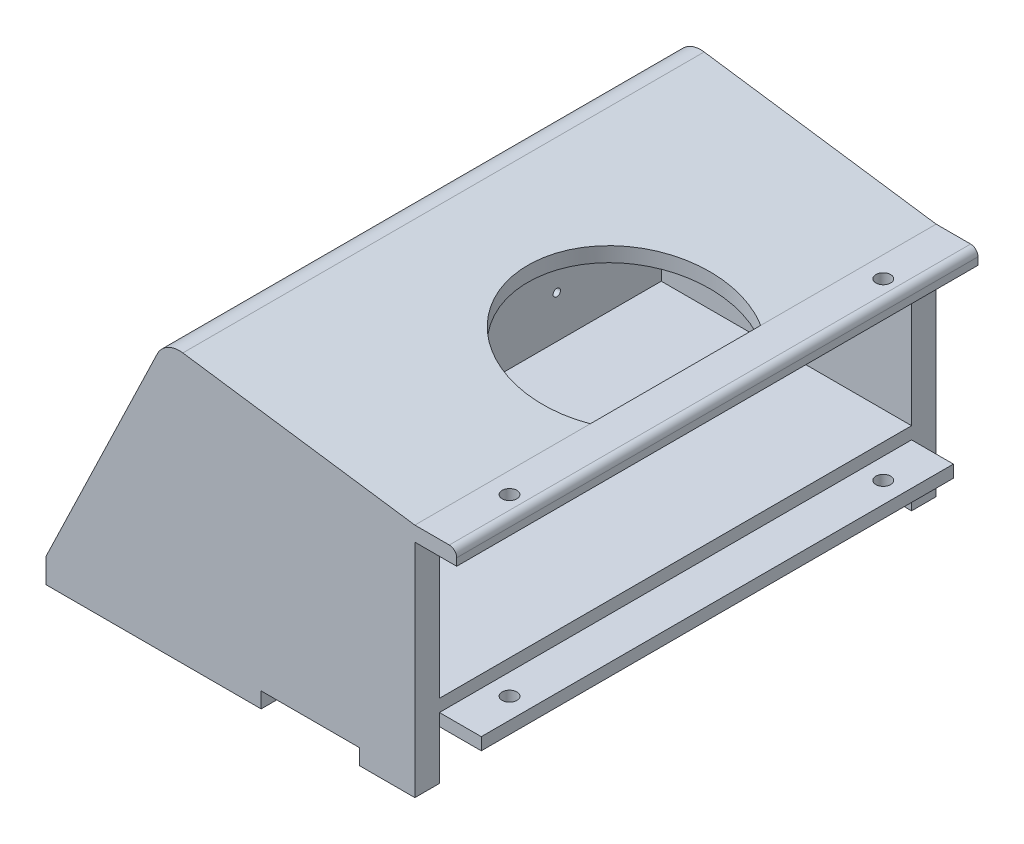
from build123d import *

# Parameters (mm, degrees)
BOSS_EXTRUDE1_DEPTH     = 212
CUT_EXTRUDE1_REACH      = 286.655
SKETCH2_W               = 17.02
SKETCH2_H               = 10
SKETCH3_R               = 1.5
CUT_EXTRUDE2_DEPTH      = 15
CUT_EXTRUDE3_DEPTH      = 292.629987014
CUT_EXTRUDE3_DEPTH_BACK = 292.629987014
SKETCH4_R               = 3
SKETCH5_W               = 30
SKETCH5_H               = 15
CUT_EXTRUDE4_DEPTH      = 15
CUT_EXTRUDE5_DEPTH      = 287.453626963
CUT_EXTRUDE5_DEPTH_BACK = 287.453626963
SKETCH6_R               = 3
BOSS_EXTRUDE2_DEPTH     = 10
BOSS_EXTRUDE3_DEPTH     = 10
CUT_EXTRUDE6_DEPTH      = 287.453626963
CUT_EXTRUDE6_DEPTH_BACK = 287.453626963
SKETCH9_W               = 40
SKETCH9_H               = 6.35
CUT_EXTRUDE9_DEPTH      = 25
CUT_EXTRUDE9_DEPTH_BACK = 27
SKETCH11_R              = 7.5
CUT_EXTRUDE10_DEPTH     = 288.989964348
SKETCH12_R              = 4
CUT_EXTRUDE11_DEPTH     = 264.602807269
FILLET2_R               = 10
FILLET3_R               = 3


with BuildPart() as part:
    # Sketch1 → Boss-Extrude1 (new body)
    with BuildSketch(Plane.XY):
        Polygon((0, 0), (0, -6), (-17.02, -6), (-118.8, 8.518342212), (-118.8, -66), (-17.02, -66), (-17.02, -71), (0, -71), (0, -76), (-130.862615106, -76), (-147.02, -96), (-167.02, -96), (-167.02, -86), (-118.611740262, 14.491488024), (-17.02, 0), align=None)
    extrude(amount=BOSS_EXTRUDE1_DEPTH)

    # Sketch2 → Cut-Extrude1 (cut, up to next)
    with BuildSketch(Plane.XZ.offset(76), mode=Mode.PRIVATE) as cut_extrude1_sk1:
        with Locations((-8.51, 207)):
            Rectangle(SKETCH2_W, SKETCH2_H)
    cut_extrude1_tool1 = extrude(cut_extrude1_sk1.sketch, amount=-CUT_EXTRUDE1_REACH, mode=Mode.PRIVATE) & part.part
    # Sketch2 → Cut-Extrude1 (cut, up to next)
    with BuildSketch(Plane.XZ.offset(76), mode=Mode.PRIVATE) as cut_extrude1_sk2:
        with Locations((-8.51, 5)):
            Rectangle(SKETCH2_W, SKETCH2_H)
    cut_extrude1_tool2 = extrude(cut_extrude1_sk2.sketch, amount=-CUT_EXTRUDE1_REACH, mode=Mode.PRIVATE) & part.part
    add(cut_extrude1_tool1.solids().sort_by_distance((-8.51, -76, 207))[0], mode=Mode.SUBTRACT)
    add(cut_extrude1_tool2.solids().sort_by_distance((-8.51, -76, 5))[0], mode=Mode.SUBTRACT)

    # Sketch3 → Cut-Extrude2 (cut)
    with BuildSketch(Plane(origin=(-118.8, 0, 0), x_dir=(0, 0, -1), z_dir=(1, 0, 0))):
        with Locations((-159.5, -8.731657788)):
            Circle(SKETCH3_R)
        with Locations((-159.5, -48.731657788)):
            Circle(SKETCH3_R)
        with Locations((-52.5, -48.731657788)):
            Circle(SKETCH3_R)
        with Locations((-52.5, -8.731657788)):
            Circle(SKETCH3_R)
    extrude(amount=-CUT_EXTRUDE2_DEPTH, mode=Mode.SUBTRACT)

    # Sketch4 → Cut-Extrude3 (cut, two sides: drawn at the far end of the back side and taken through both)
    with BuildSketch(Plane(origin=(0, -96, 0), x_dir=(1, 0, 0), z_dir=(0, 1, 0)).offset(-CUT_EXTRUDE3_DEPTH_BACK)):
        with Locations((-157.02, -187)):
            Circle(SKETCH4_R)
        with Locations((-157.02, -25)):
            Circle(SKETCH4_R)
    extrude(amount=CUT_EXTRUDE3_DEPTH + CUT_EXTRUDE3_DEPTH_BACK, mode=Mode.SUBTRACT)

    # Sketch5 → Cut-Extrude4 (cut)
    with BuildSketch(Plane(origin=(0, -66, 0), x_dir=(1, 0, 0), z_dir=(0, 1, 0))):
        with Locations((-98.8, -184.31184426)):
            Rectangle(SKETCH5_W, SKETCH5_H)
    extrude(amount=-CUT_EXTRUDE4_DEPTH, mode=Mode.SUBTRACT)

    # Sketch6 → Cut-Extrude5 (cut, two sides: drawn at the far end of the back side and taken through both)
    with BuildSketch(Plane(origin=(0, 0, 0), x_dir=(1, 0, 0), z_dir=(0, 1, 0)).offset(-CUT_EXTRUDE5_DEPTH_BACK)):
        with Locations((-8.52, -30)):
            Circle(SKETCH6_R)
        with Locations((-8.52, -182)):
            Circle(SKETCH6_R)
    extrude(amount=CUT_EXTRUDE5_DEPTH + CUT_EXTRUDE5_DEPTH_BACK, mode=Mode.SUBTRACT)

    # Sketch7 → Boss-Extrude2 (add)
    with BuildSketch(Plane.XY.offset(212)):
        Polygon((-17.02, 0), (-118.611740262, 14.491488024), (-167.02, -86), (-167.02, -96), (-17.02, -96), align=None)
    extrude(amount=-BOSS_EXTRUDE2_DEPTH)

    # Sketch8 → Boss-Extrude3 (add)
    with BuildSketch(Plane(origin=(0, 0, 0), x_dir=(-1, 0, 0), z_dir=(0, 0, -1))):
        Polygon((167.02, -86), (167.02, -96), (17.02, -96), (17.02, 0), (118.611740262, 14.491488024), align=None)
    extrude(amount=-BOSS_EXTRUDE3_DEPTH)

    # Sketch9 → Cut-Extrude6 (cut, two sides: drawn at the far end of the back side and taken through both)
    with BuildSketch(Plane.XY.offset(212).offset(-CUT_EXTRUDE6_DEPTH_BACK)):
        with Locations((-59.52, -92.825)):
            Rectangle(SKETCH9_W, SKETCH9_H)
    extrude(amount=CUT_EXTRUDE6_DEPTH + CUT_EXTRUDE6_DEPTH_BACK, mode=Mode.SUBTRACT)

    # Sketch10 → Cut-Extrude9 (cut, two sides: drawn at the far end of the back side and taken through both)
    with BuildSketch(Plane(origin=(0, 0, 0), x_dir=(1, 0, 0), z_dir=(0, 1, 0)).offset(-CUT_EXTRUDE9_DEPTH_BACK)):
        with BuildLine():
            Line((-17.02, -140.641016151), (-17.02, -71.358983849))
            ThreePointArc((-17.02, -71.358983849), (-77.02, -106), (-17.02, -140.641016151))
        make_face()
    extrude(amount=CUT_EXTRUDE9_DEPTH + CUT_EXTRUDE9_DEPTH_BACK, mode=Mode.SUBTRACT)

    # Sketch11 → Cut-Extrude10 (cut, through all)
    with BuildSketch(Plane(origin=(0, -86, 0), x_dir=(-1, 0, 0), z_dir=(0, -1, 0))):
        with Locations((157.02, -25)):
            Circle(SKETCH11_R)
        with Locations((157.02, -187)):
            Circle(SKETCH11_R)
    extrude(amount=-CUT_EXTRUDE10_DEPTH, mode=Mode.SUBTRACT)

    # Sketch12 → Cut-Extrude11 (cut, through all)
    with BuildSketch(Plane(origin=(-123.8, 0, 0), x_dir=(0, 0, -1), z_dir=(1, 0, 0))):
        with Locations((-159.5, -8.731657788)):
            Circle(SKETCH12_R)
        with Locations((-52.5, -8.731657788)):
            Circle(SKETCH12_R)
    extrude(amount=-CUT_EXTRUDE11_DEPTH, mode=Mode.SUBTRACT)

    # Fillet2
    fillet2_edges = [part.edges().sort_by_distance(p)[0] for p in [
        (-118.611740262, 14.491488024, 106),
    ]]
    fillet(fillet2_edges, radius=FILLET2_R)

    # Fillet3
    fillet3_edges = [part.edges().sort_by_distance(p)[0] for p in [
        (0, 0, 106),
    ]]
    fillet(fillet3_edges, radius=FILLET3_R)


solid = part.part
